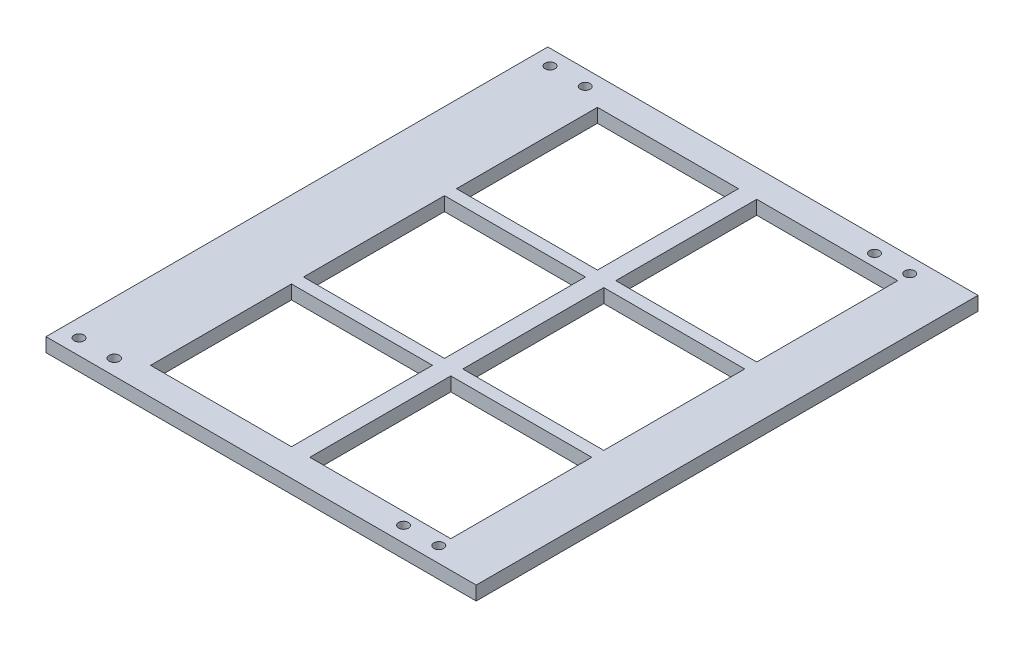
from build123d import *

# Parameters (mm, degrees)
SKETCH1_W                 = 310.095
SKETCH1_H                 = 361.68
SKETCH1_R                 = 3.57
SKETCH1_R_2               = 3.7
BOSS_EXTRUDE1_DEPTH       = 10
SKETCH2_W                 = 101.6
SKETCH2_H                 = 101.6
CUT_EXTRUDE1_DEPTH        = 253.883492591
LPATTERN1_COUNT           = 2
LPATTERN1_PITCH           = 110.265
LPATTERN2_COUNT           = 2
LPATTERN2_PITCH           = 110.265
LPATTERN3_COUNT           = 2
LPATTERN3_PITCH           = 114.82
LPATTERN3_COPY_1_SKETCH_W = 101.6
LPATTERN3_COPY_1_SKETCH_H = 101.6
LPATTERN3_COPY_1_DEPTH    = 253.883492591
LPATTERN3_COPY_2_SKETCH_W = 101.6
LPATTERN3_COPY_2_SKETCH_H = 101.6
LPATTERN3_COPY_2_DEPTH    = 253.883492591


with BuildPart() as part:
    # Sketch1 → Boss-Extrude1 (new body)
    with BuildSketch(Plane(origin=(0, 0, 0), x_dir=(1, 0, 0), z_dir=(0, 1, 0))):
        with Locations((-21.4375, 0)):
            Rectangle(SKETCH1_W, SKETCH1_H)
        with Locations((-163.785, -169.7275)):
            Circle(SKETCH1_R, mode=Mode.SUBTRACT)
        with Locations((-163.785, 169.7275)):
            Circle(SKETCH1_R, mode=Mode.SUBTRACT)
        with Locations((70.11, 169.7275)):
            Circle(SKETCH1_R, mode=Mode.SUBTRACT)
        with Locations((70.11, -169.7275)):
            Circle(SKETCH1_R, mode=Mode.SUBTRACT)
        with Locations((-138.385, 169.7275)):
            Circle(SKETCH1_R, mode=Mode.SUBTRACT)
        with Locations((-138.385, -169.7275)):
            Circle(SKETCH1_R_2, mode=Mode.SUBTRACT)
        with Locations((95.51, 169.7275)):
            Circle(SKETCH1_R, mode=Mode.SUBTRACT)
        with Locations((95.51, -169.7275)):
            Circle(SKETCH1_R, mode=Mode.SUBTRACT)
    extrude(amount=BOSS_EXTRUDE1_DEPTH)

    # Sketch2 → Cut-Extrude1 (cut, through all)
    with BuildSketch(Plane(origin=(0, 10, 0), x_dir=(1, 0, 0), z_dir=(0, 1, 0))):
        with Locations((-70.11, 0)):
            Rectangle(SKETCH2_W, SKETCH2_H)
    cut_extrude1 = extrude(amount=-CUT_EXTRUDE1_DEPTH, mode=Mode.SUBTRACT)

    # LPattern1: Cut-Extrude1 ×2
    with Locations(*[(0, 0, -i * LPATTERN1_PITCH) for i in range(1, LPATTERN1_COUNT)]):
        add(cut_extrude1, mode=Mode.SUBTRACT)

    # LPattern2: Cut-Extrude1 ×2
    with Locations(*[(0, 0, i * LPATTERN2_PITCH) for i in range(1, LPATTERN2_COUNT)]):
        add(cut_extrude1, mode=Mode.SUBTRACT)

    # LPattern3: Cut-Extrude1 ×2
    with Locations(*[(i * LPATTERN3_PITCH, 0, 0) for i in range(1, LPATTERN3_COUNT)]):
        add(cut_extrude1, mode=Mode.SUBTRACT)

    # LPattern3 copy 1 sketch → LPattern3 copy 1 (cut, through all)
    with BuildSketch(Plane(origin=(114.82, 10, -110.265), x_dir=(1, 0, 0), z_dir=(0, 1, 0))):
        with Locations((-70.11, 0)):
            Rectangle(LPATTERN3_COPY_1_SKETCH_W, LPATTERN3_COPY_1_SKETCH_H)
    extrude(amount=-LPATTERN3_COPY_1_DEPTH, mode=Mode.SUBTRACT)

    # LPattern3 copy 2 sketch → LPattern3 copy 2 (cut, through all)
    with BuildSketch(Plane(origin=(114.82, 10, 110.265), x_dir=(1, 0, 0), z_dir=(0, 1, 0))):
        with Locations((-70.11, 0)):
            Rectangle(LPATTERN3_COPY_2_SKETCH_W, LPATTERN3_COPY_2_SKETCH_H)
    extrude(amount=-LPATTERN3_COPY_2_DEPTH, mode=Mode.SUBTRACT)


solid = part.part
